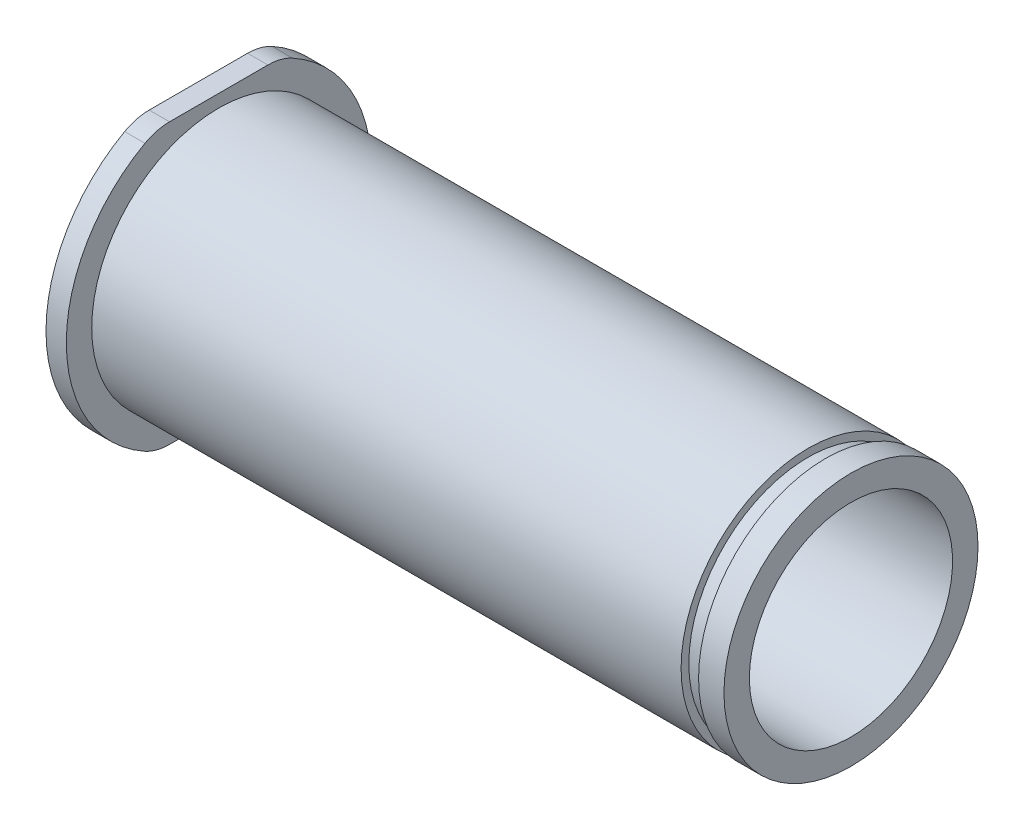
from build123d import *

# Parameters (mm, degrees)
CUT_EXTRUDE1_REACH = 87.894
SKETCH2_W          = 15.226765086
SKETCH2_H          = 1.5875
FILLET1_R          = 6.35


with BuildPart() as part:
    # Sketch1 → Revolve1 (revolve)
    with BuildSketch(Plane.XY):
        Polygon((0, 12.7), (81.5594, 12.7), (81.5594, 15.875), (78.3844, 15.875), (78.3844, 14.9098), (76.2, 14.9098), (76.2, 15.875), (2.54, 15.875), (2.54, 19.05), (0, 19.05), align=None)
    revolve(axis=Axis((0, 0, 0), (1, 0, 0)))

    # Sketch2 → Cut-Extrude1 (cut, up to next)
    with BuildSketch(Plane.ZY, mode=Mode.PRIVATE) as cut_extrude1_sk1:
        with Locations((0, 18.25625)):
            Rectangle(SKETCH2_W, SKETCH2_H)
    cut_extrude1_tool1 = extrude(cut_extrude1_sk1.sketch, amount=-CUT_EXTRUDE1_REACH, mode=Mode.PRIVATE) & part.part
    # Sketch2 → Cut-Extrude1 (cut, up to next)
    with BuildSketch(Plane.ZY, mode=Mode.PRIVATE) as cut_extrude1_sk2:
        with Locations((0, -18.25625)):
            Rectangle(SKETCH2_W, SKETCH2_H)
    cut_extrude1_tool2 = extrude(cut_extrude1_sk2.sketch, amount=-CUT_EXTRUDE1_REACH, mode=Mode.PRIVATE) & part.part
    add(cut_extrude1_tool1.solids().sort_by_distance((0, 18.25625, 0))[0], mode=Mode.SUBTRACT)
    add(cut_extrude1_tool2.solids().sort_by_distance((0, -18.25625, 0))[0], mode=Mode.SUBTRACT)

    # Fillet1
    fillet1_edges = [part.edges().sort_by_distance(p)[0] for p in [
        (1.27, -17.4625, -7.613382543),
        (1.27, -17.4625, 7.613382543),
        (1.27, 17.4625, -7.613382543),
        (1.27, 17.4625, 7.613382543),
    ]]
    fillet(fillet1_edges, radius=FILLET1_R)


solid = part.part
